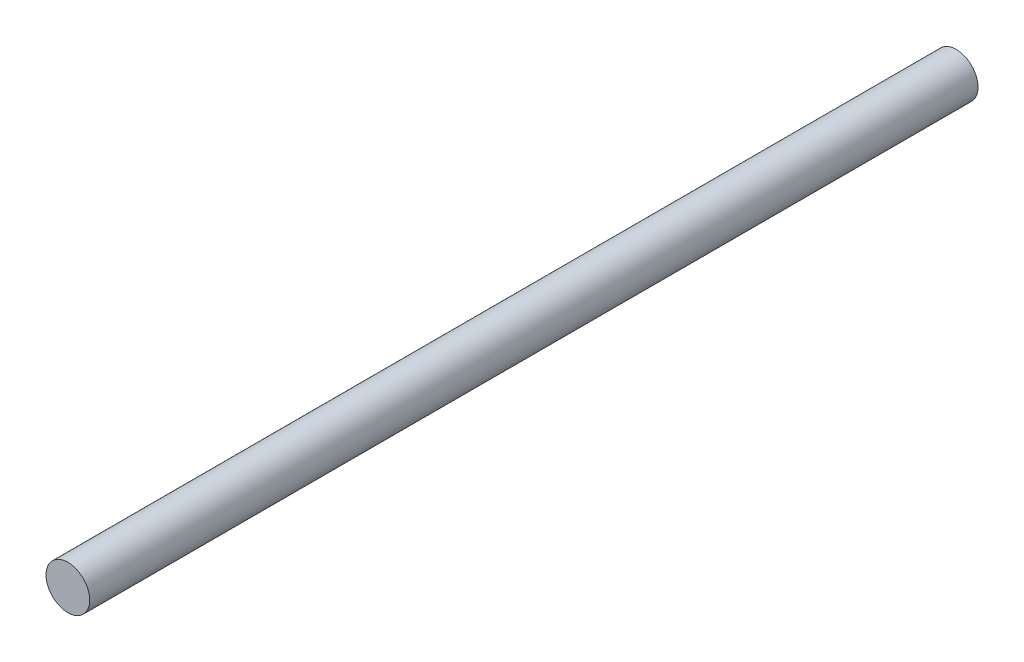
from build123d import *

# Parameters (mm, degrees)
SKETCH1_R           = 1.5
BOSS_EXTRUDE1_DEPTH = 61


with BuildPart() as part:
    # Sketch1 → Boss-Extrude1 (new body)
    with BuildSketch(Plane.XY):
        Circle(SKETCH1_R)
    extrude(amount=BOSS_EXTRUDE1_DEPTH)


solid = part.part
